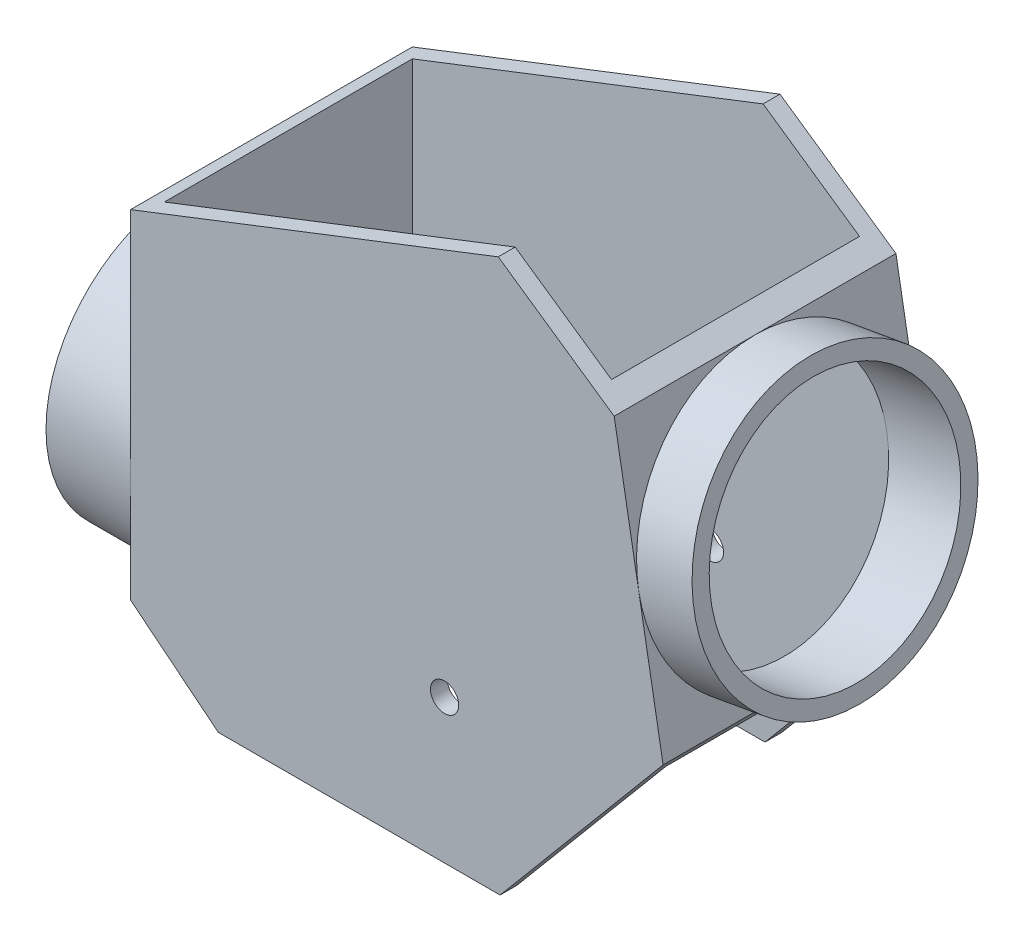
from build123d import *

# Parameters (mm, degrees)
BOSS_EXTRU_1_DEPTH      = 50
ESQUISSE3_R             = 25
BOSS_EXTRU_2_DEPTH      = 10
ESQUISSE4_R             = 25
BOSS_EXTRU_3_DEPTH      = 15
COQUE2_START            = 3
COQUE2_DEPTH            = 44
ESQUISSE6_R             = 2.5
ENL_V_MAT_EXTRU_1_DEPTH = 109.272397717


with BuildPart() as part:
    # Esquisse1 → Boss.-Extru.1 (new body)
    with BuildSketch(Plane.XY):
        Polygon((-31.809910954, -22.428852102), (-16.234936413, -34.975571516), (33.765063587, -34.975571516), (62.690506023, -0.503571576), (54.008097139, 48.736816075), (33.432510355, 62.937000175), (-31.809910954, 37.571147898), align=None)
    extrude(amount=BOSS_EXTRU_1_DEPTH)

    # Esquisse3 → Boss.-Extru.2 (add)
    with BuildSketch(Plane(origin=(60.714040151, 10.705523386, 0), x_dir=(0, 0, -1), z_dir=(0.9848077530122085, 0.17364817766692822, 0))):
        with Locations(Location((-25, 13.61798668, 0), (0, 0, 90))):
            Circle(ESQUISSE3_R)
    extrude(amount=BOSS_EXTRU_2_DEPTH)

    # Esquisse4 → Boss.-Extru.3 (add, symmetric)
    with BuildSketch(Plane.ZY.offset(31.809910954)):
        with Locations((25, -3.702211809)):
            Circle(ESQUISSE4_R)
    extrude(amount=BOSS_EXTRU_3_DEPTH, both=True)

    # Coque2: read off the stored shape, not the designer's step
    # Coque2 outline → Coque2 (cut)
    with BuildSketch(Plane.XY.offset(COQUE2_START)):
        Polygon((-28.809910954, 38.737529453), (-28.809910954, -20.993225887), (-11.452809865, -34.975571516), (33.765063587, -34.975571516), (60.173207129, -3.503571576), (55.394878322, 23.595677716), (50.539748489, 51.130487267), (33.432510355, 62.937000175), align=None)
    extrude(amount=COQUE2_DEPTH, mode=Mode.SUBTRACT)

    # Coque2 2: loft between two sections, ruled curve by curve
    coque2_2_from = [
        Edge.make_three_point_arc((68.197379111, 25.853104026, 3), (72.01763902, 4.18733346, 25), (68.197379111, 25.853104026, 47)),
        Edge.make_three_point_arc((68.197379111, 25.853104026, 47), (64.377119202, 47.518874592, 25), (68.197379111, 25.853104026, 3)),
    ]
    coque2_2_to = [
        Edge.make_three_point_arc((55.394878322, 23.595677716, 3), (59.21513823, 1.92990715, 25), (55.394878322, 23.595677716, 47)),
        Edge.make_three_point_arc((55.394878322, 23.595677716, 47), (51.574618413, 45.261448283, 25), (55.394878322, 23.595677716, 3)),
    ]
    coque2_2 = Solid(Shell([*[Face.make_surface_from_curves(coque2_2_from[k], coque2_2_to[k]) for k in range(2)], Face(Wire(coque2_2_from)), Face(Wire(coque2_2_to))]))
    add(coque2_2, mode=Mode.SUBTRACT)

    # Coque2 3: loft between two sections, ruled curve by curve
    coque2_3_from = [
        Edge.make_three_point_arc((-46.809910954, -3.702211809, 47), (-46.809910954, -25.702211809, 25), (-46.809910954, -3.702211809, 3)),
        Edge.make_three_point_arc((-46.809910954, -3.702211809, 3), (-46.809910954, 18.297788191, 25), (-46.809910954, -3.702211809, 47)),
    ]
    coque2_3_to = [
        Edge.make_three_point_arc((-22.947653862, -3.702211809, 47), (-22.947653862, -25.702211809, 25), (-22.947653862, -3.702211809, 3)),
        Edge.make_three_point_arc((-22.947653862, -3.702211809, 3), (-22.947653862, 18.297788191, 25), (-22.947653862, -3.702211809, 47)),
    ]
    coque2_3 = Solid(Shell([*[Face.make_surface_from_curves(coque2_3_from[k], coque2_3_to[k]) for k in range(2)], Face(Wire(coque2_3_from)), Face(Wire(coque2_3_to))]))
    add(coque2_3, mode=Mode.SUBTRACT)

    # Esquisse6 → Enlèv. mat.-Extru.1 (cut, through all)
    with BuildSketch(Plane.XY.offset(50)):
        with Locations((23.91500674, -9.499973142)):
            Circle(ESQUISSE6_R)
    extrude(amount=-ENL_V_MAT_EXTRU_1_DEPTH, mode=Mode.SUBTRACT)


solid = part.part
